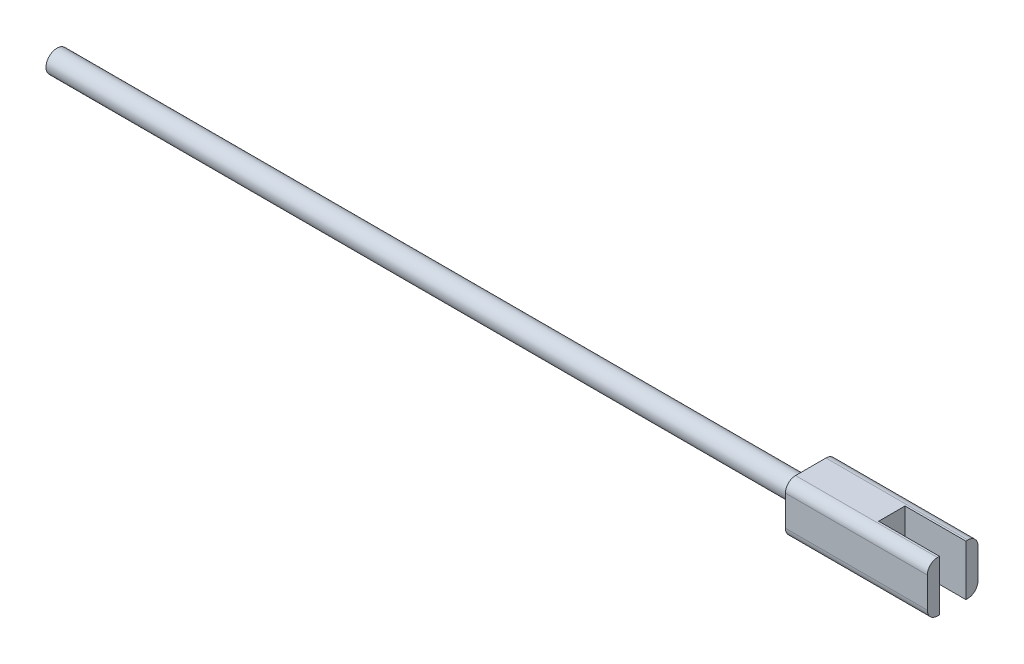
from build123d import *

# Parameters (mm, degrees)
SKETCH1_R               = 1.09
BOSS_EXTRUDE1_DEPTH     = 76.354
BOSS_EXTRUDE2_DEPTH     = 14
CUT_EXTRUDE1_DEPTH      = 89.424709872
CUT_EXTRUDE1_DEPTH_BACK = 89.424709872
SKETCH3_W               = 7
SKETCH3_H               = 2.6


with BuildPart() as part:
    # Sketch1 → Boss-Extrude1 (new body)
    with BuildSketch(Plane(origin=(0, 0, 0), x_dir=(0, 0, -1), z_dir=(1, 0, 0))):
        Circle(SKETCH1_R)
    extrude(amount=BOSS_EXTRUDE1_DEPTH)

    # Sketch2 → Boss-Extrude2 (add)
    with BuildSketch(Plane(origin=(74.354, 0, 0), x_dir=(0, 0, -1), z_dir=(1, 0, 0))):
        with BuildLine():
            Line((-1.5, -2.5), (1.5, -2.5))
            ThreePointArc((1.5, -2.5), (2.207106781, -2.207106781), (2.5, -1.5))
            Line((2.5, -1.5), (2.5, 1.5))
            ThreePointArc((2.5, 1.5), (2.207106781, 2.207106781), (1.5, 2.5))
            Line((1.5, 2.5), (-1.5, 2.5))
            ThreePointArc((-1.5, 2.5), (-2.207106781, 2.207106781), (-2.5, 1.5))
            Line((-2.5, 1.5), (-2.5, -1.5))
            ThreePointArc((-2.5, -1.5), (-2.207106781, -2.207106781), (-1.5, -2.5))
        make_face()
    extrude(amount=BOSS_EXTRUDE2_DEPTH)

    # Sketch3 → Cut-Extrude1 (cut, two sides: drawn at the far end of the back side and taken through both)
    with BuildSketch(Plane(origin=(0, 0, 0), x_dir=(1, 0, 0), z_dir=(0, 1, 0)).offset(-CUT_EXTRUDE1_DEPTH_BACK)):
        with Locations((85.854, 0)):
            Rectangle(SKETCH3_W, SKETCH3_H)
    extrude(amount=CUT_EXTRUDE1_DEPTH + CUT_EXTRUDE1_DEPTH_BACK, mode=Mode.SUBTRACT)


solid = part.part
